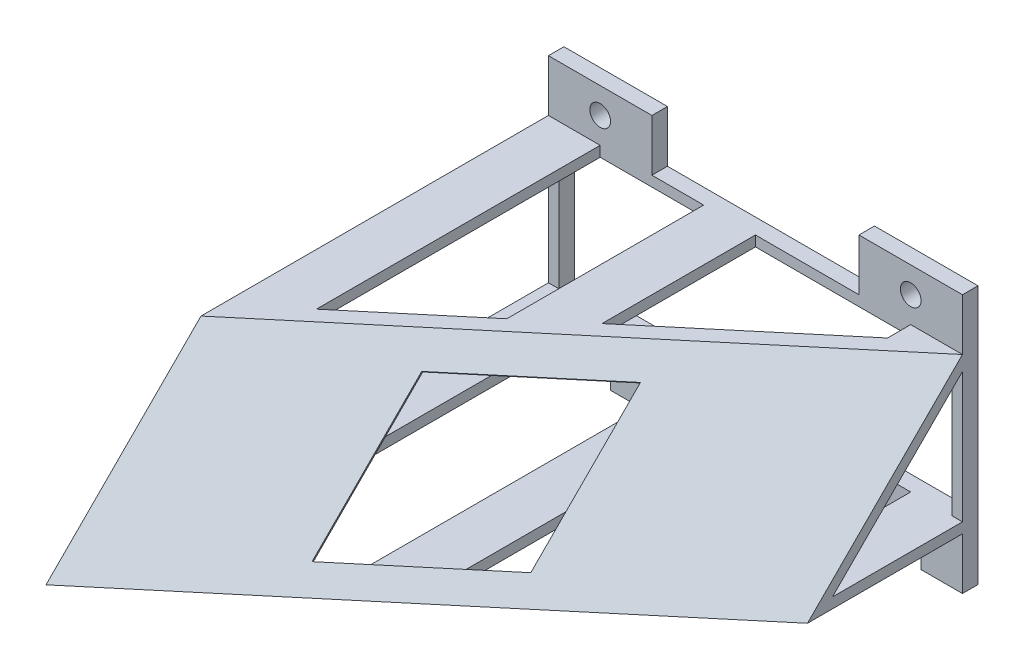
from build123d import *

# Parameters (mm, degrees)
SKETCH_2_W           = 240
SKETCH_2_H           = 150
EXTRUDE_1_DEPTH      = 250
CUT_EXTRUDE_1_DEPTH  = 200
CUT_REVOLVE_1_ANGLE  = 37.4
SKETCH_13_W          = 80
SKETCH_13_H          = 100
CUT_EXTRUDE_2_DEPTH  = 295
SKETCH_14_W          = 160
SKETCH_14_H          = 150
CUT_EXTRUDE_3_DEPTH  = 295
SKETCH_16_W          = 80
SKETCH_16_H          = 28.16
CUT_EXTRUDE_4_DEPTH  = 295
SKETCH_22_W          = 80
SKETCH_22_H          = 9.999058643
CUT_EXTRUDE_5_DEPTH  = 120
SKETCH_23_W          = 80
SKETCH_23_H          = 9.99833939
CUT_EXTRUDE_6_DEPTH  = 142
SKETCH_24_W          = 80
SKETCH_24_H          = 11.98
CUT_EXTRUDE_7_DEPTH  = 142
SKETCH_25_W          = 20
SKETCH_25_H          = 3
EXTRUDE_2_DEPTH      = 10
SKETCH_26_W          = 20
SKETCH_26_H          = 3
EXTRUDE_3_DEPTH      = 10
SKETCH_27_W          = 20
SKETCH_27_H          = 3
EXTRUDE_4_DEPTH      = 10
SKETCH_28_W          = 20
SKETCH_28_H          = 3
EXTRUDE_5_DEPTH      = 10
SKETCH_29_R          = 1.997024656
CUT_EXTRUDE_8_DEPTH  = 10
SKETCH_30_R          = 1.996157305
CUT_EXTRUDE_9_DEPTH  = 10
CUT_EXTRUDE_10_DEPTH = 10
CUT_EXTRUDE_11_DEPTH = 10
SKETCH_34_W          = 76
SKETCH_34_H          = 26.002601967
CUT_EXTRUDE_14_DEPTH = 2
CUT_EXTRUDE_15_DEPTH = 2
CUT_EXTRUDE_17_DEPTH = 2
CUT_EXTRUDE_18_DEPTH = 2
CUT_EXTRUDE_20_DEPTH = 2
CUT_EXTRUDE_22_DEPTH = 2


with BuildPart() as part:
    # 草图2 → 凸台-拉伸1 (new body)
    with BuildSketch(Plane.XY):
        Rectangle(SKETCH_2_W, SKETCH_2_H)
    extrude(amount=EXTRUDE_1_DEPTH)

    # 草图9 → 切除-拉伸1 (cut)
    with BuildSketch(Plane(origin=(0, 75, 0), x_dir=(1, 0, 0), z_dir=(0, 1, 0))):
        Polygon((120, -250), (-120, -250), (208.236072982, 25.422767778), align=None)
    extrude(amount=-CUT_EXTRUDE_1_DEPTH, mode=Mode.SUBTRACT)

    # 草图10 → 切除-旋转1 (revolve, cut)
    with BuildSketch(Plane(origin=(73.519859787, 0, 87.617557028), x_dir=(0.7660444431189816, 0, -0.6427876096865353), z_dir=(0.6427876096865353, 0, 0.7660444431189817))):
        Polygon((60.675513844, -75), (-252.622235596, -75), (-252.622235596, 287.743692907), (60.675513844, 234.486341656), align=None)
    revolve(axis=Axis((120, -75, 48.616088517), (-0.7660444431189815, 0, 0.6427876096865353)), revolution_arc=CUT_REVOLVE_1_ANGLE, mode=Mode.SUBTRACT)

    # 草图13 → 切除-拉伸2 (cut)
    with BuildSketch(Plane(origin=(0, 0, 0), x_dir=(-1, 0, 0), z_dir=(0, 0, -1))):
        with Locations((80, -25)):
            Rectangle(SKETCH_13_W, SKETCH_13_H)
    extrude(amount=-CUT_EXTRUDE_2_DEPTH, mode=Mode.SUBTRACT)

    # 草图14 → 切除-拉伸3 (cut)
    with BuildSketch(Plane(origin=(0, 0, 0), x_dir=(-1, 0, 0), z_dir=(0, 0, -1))):
        with Locations((-40, 0)):
            Rectangle(SKETCH_14_W, SKETCH_14_H)
    extrude(amount=-CUT_EXTRUDE_3_DEPTH, mode=Mode.SUBTRACT)

    # 草图16 → 切除-拉伸4 (cut)
    with BuildSketch(Plane(origin=(0, 75, 0), x_dir=(1, 0, 0), z_dir=(0, 1, 0))):
        with Locations((-80, -14.08)):
            Rectangle(SKETCH_16_W, SKETCH_16_H)
    extrude(amount=-CUT_EXTRUDE_4_DEPTH, mode=Mode.SUBTRACT)

    # 草图22 → 切除-拉伸5 (cut)
    with BuildSketch(Plane(origin=(0, 0, 28.16), x_dir=(-1, 0, 0), z_dir=(0, 0, -1))):
        with Locations((80, 70.000470678)):
            Rectangle(SKETCH_22_W, SKETCH_22_H)
    extrude(amount=-CUT_EXTRUDE_5_DEPTH, mode=Mode.SUBTRACT)

    # 草图23 → 切除-拉伸6 (cut)
    with BuildSketch(Plane(origin=(0, 0, 28.16), x_dir=(-1, 0, 0), z_dir=(0, 0, -1))):
        with Locations((80, 29.999169695)):
            Rectangle(SKETCH_23_W, SKETCH_23_H)
    extrude(amount=-CUT_EXTRUDE_6_DEPTH, mode=Mode.SUBTRACT)

    # 草图24 → 切除-拉伸7 (cut)
    with BuildSketch(Plane(origin=(0, 65.000941357, 0), x_dir=(1, 0, 0), z_dir=(0, 1, 0))):
        with Locations((-80, -34.15)):
            Rectangle(SKETCH_24_W, SKETCH_24_H)
    extrude(amount=-CUT_EXTRUDE_7_DEPTH, mode=Mode.SUBTRACT)

    # 草图25 → 凸台-拉伸2 (add)
    with BuildSketch(Plane(origin=(0, 65.000941357, 0), x_dir=(1, 0, 0), z_dir=(0, 1, 0))):
        with Locations((-50, -41.64)):
            Rectangle(SKETCH_25_W, SKETCH_25_H)
    extrude(amount=EXTRUDE_2_DEPTH)

    # 草图26 → 凸台-拉伸3 (add)
    with BuildSketch(Plane(origin=(0, 65.000941357, 0), x_dir=(1, 0, 0), z_dir=(0, 1, 0))):
        with Locations((-110, -41.64)):
            Rectangle(SKETCH_26_W, SKETCH_26_H)
    extrude(amount=EXTRUDE_3_DEPTH)

    # 草图27 → 凸台-拉伸4 (add)
    with BuildSketch(Plane.XZ.offset(-34.99833939)):
        with Locations((-50, 41.64)):
            Rectangle(SKETCH_27_W, SKETCH_27_H)
    extrude(amount=EXTRUDE_4_DEPTH)

    # 草图28 → 凸台-拉伸5 (add)
    with BuildSketch(Plane.XZ.offset(-34.99833939)):
        with Locations((-110, 41.64)):
            Rectangle(SKETCH_28_W, SKETCH_28_H)
    extrude(amount=EXTRUDE_5_DEPTH)

    # 草图29 → 切除-拉伸8 (cut)
    with BuildSketch(Plane.XY.offset(43.14)):
        with Locations((-110, 69.998446832)):
            Circle(SKETCH_29_R)
    extrude(amount=-CUT_EXTRUDE_8_DEPTH, mode=Mode.SUBTRACT)

    # 草图30 → 切除-拉伸9 (cut)
    with BuildSketch(Plane.XY.offset(43.14)):
        with Locations((-50, 70.000941357)):
            Circle(SKETCH_30_R)
    extrude(amount=-CUT_EXTRUDE_9_DEPTH, mode=Mode.SUBTRACT)

    # 草图31 → 切除-拉伸10 (cut)
    with BuildSketch(Plane(origin=(0, 0, 40.14), x_dir=(-1, 0, 0), z_dir=(0, 0, -1))):
        with BuildLine():
            ThreePointArc((52, 29.962991919), (50, 31.962991919), (48, 29.962991919))
            Line((48, 29.962991919), (50, 29.962991919))
            Line((50, 29.962991919), (52, 29.962991919))
        make_face()
        with BuildLine():
            Line((48, 29.962991919), (48, 24.99833939))
            Line((48, 24.99833939), (50, 24.99833939))
            Line((50, 24.99833939), (50, 27.962991919))
            ThreePointArc((50, 27.962991919), (48.585786438, 28.548778357), (48, 29.962991919))
        make_face()
        with BuildLine():
            Line((50, 27.962991919), (50, 24.99833939))
            Line((50, 24.99833939), (52, 24.99833939))
            Line((52, 24.99833939), (52, 29.962991919))
            ThreePointArc((52, 29.962991919), (51.414213562, 28.548778357), (50, 27.962991919))
        make_face()
        with BuildLine():
            Line((50, 29.962991919), (48, 29.962991919))
            ThreePointArc((48, 29.962991919), (48.585786438, 28.548778357), (50, 27.962991919))
            Line((50, 27.962991919), (50, 29.962991919))
        make_face()
        with BuildLine():
            Line((50, 29.962991919), (50, 27.962991919))
            ThreePointArc((50, 27.962991919), (51.414213562, 28.548778357), (52, 29.962991919))
            Line((52, 29.962991919), (50, 29.962991919))
        make_face()
    extrude(amount=-CUT_EXTRUDE_10_DEPTH, mode=Mode.SUBTRACT)

    # 草图32 → 切除-拉伸11 (cut)
    with BuildSketch(Plane(origin=(0, 0, 40.14), x_dir=(-1, 0, 0), z_dir=(0, 0, -1))):
        with BuildLine():
            Line((112, 24.99833939), (112, 29.99833939))
            ThreePointArc((112, 29.99833939), (110, 31.99833939), (108, 29.99833939))
            Line((108, 29.99833939), (108, 24.99833939))
            Line((108, 24.99833939), (112, 24.99833939))
        make_face()
    extrude(amount=-CUT_EXTRUDE_11_DEPTH, mode=Mode.SUBTRACT)

    # 抽壳9: read off the stored shape, not the designer's step
    # 抽壳9: loft between two sections, ruled curve by curve
    shell_9_from = [
        Edge.make_line((-118, 36.99833939, 133.254360386), (-118, 36.99833939, 42.14)),
        Edge.make_line((-118, 36.99833939, 133.254360386), (-42, 36.99833939, 69.482788417)),
        Edge.make_line((-42, 36.99833939, 69.482788417), (-42, 36.99833939, 42.14)),
        Edge.make_line((-118, 36.99833939, 42.14), (-42, 36.99833939, 42.14)),
    ]
    shell_9_to = [
        Edge.make_line((-118, 63.000941357, 107.302223356), (-118, 63.000941357, 42.14)),
        Edge.make_line((-118, 63.000941357, 107.302223356), (-42, 63.000941357, 43.530651387)),
        Edge.make_line((-42, 63.000941357, 43.530651387), (-42, 63.000941357, 42.14)),
        Edge.make_line((-118, 63.000941357, 42.14), (-42, 63.000941357, 42.14)),
    ]
    shell_9 = Solid(Shell([*[Face.make_surface_from_curves(shell_9_from[k], shell_9_to[k]) for k in range(4)], Face(Wire(shell_9_from)), Face(Wire(shell_9_to))]))
    add(shell_9, mode=Mode.SUBTRACT)

    # 草图34 → 切除-拉伸14 (cut)
    with BuildSketch(Plane(origin=(0, 0, 40.14), x_dir=(-1, 0, 0), z_dir=(0, 0, -1))):
        with Locations((80, 49.999640374)):
            Rectangle(SKETCH_34_W, SKETCH_34_H)
    extrude(amount=-CUT_EXTRUDE_14_DEPTH, mode=Mode.SUBTRACT)

    # 草图35 → 切除-拉伸15 (cut)
    with BuildSketch(Plane.ZY.offset(120)):
        Polygon((43.14, 63.000941357), (109.441202222, 63.000941357), (135.393339252, 36.99833939), (43.14, 36.99833939), align=None)
    extrude(amount=-CUT_EXTRUDE_15_DEPTH, mode=Mode.SUBTRACT)

    # 草图37 → 切除-拉伸17 (cut)
    with BuildSketch(Plane(origin=(-40, 0, 0), x_dir=(0, 0, -1), z_dir=(1, 0, 0))):
        Polygon((-43.14, 36.99833939), (-68.265368758, 36.99833939), (-43.14, 62.172565402), align=None)
    extrude(amount=-CUT_EXTRUDE_17_DEPTH, mode=Mode.SUBTRACT)

    # 草图38 → 切除-拉伸18 (cut)
    with BuildSketch(Plane.XZ.offset(-34.99833939)):
        Polygon((-110, 43.14), (-110, 127.907923344), (-90, 111.12593072), (-90, 43.14), align=None)
        Polygon((-50, 43.14), (-50, 77.561945473), (-80, 102.734934409), (-80, 43.14), align=None)
    extrude(amount=-CUT_EXTRUDE_18_DEPTH, mode=Mode.SUBTRACT)

    # 草图39 → 切除-拉伸20 (cut)
    with BuildSketch(Plane(origin=(0, 65.000941357, 0), x_dir=(1, 0, 0), z_dir=(0, 1, 0))):
        Polygon((-110, -43.14), (-110, -97.963549373), (-90, -81.18155675), (-90, -43.14), align=None)
        Polygon((-50, -43.14), (-50, -47.617571503), (-80, -72.790560438), (-80, -43.14), align=None)
    extrude(amount=-CUT_EXTRUDE_20_DEPTH, mode=Mode.SUBTRACT)

    # 草图40 → 切除-拉伸22 (cut)
    with BuildSketch(Plane(origin=(23.136711502, 27.51974584, 27.573259053), x_dir=(0.8597946952762991, -0.3607260251766269, -0.3614274709191423), z_dir=(0.5106398750339969, 0.6073758397232878, 0.6085569055936306))):
        Polygon((-109.748917815, -9.755427356), (-136.477779275, -23.377760676), (-136.477779275, -53.377760676), (-109.748917815, -39.755427356), align=None)
    extrude(amount=-CUT_EXTRUDE_22_DEPTH, mode=Mode.SUBTRACT)


solid = part.part
